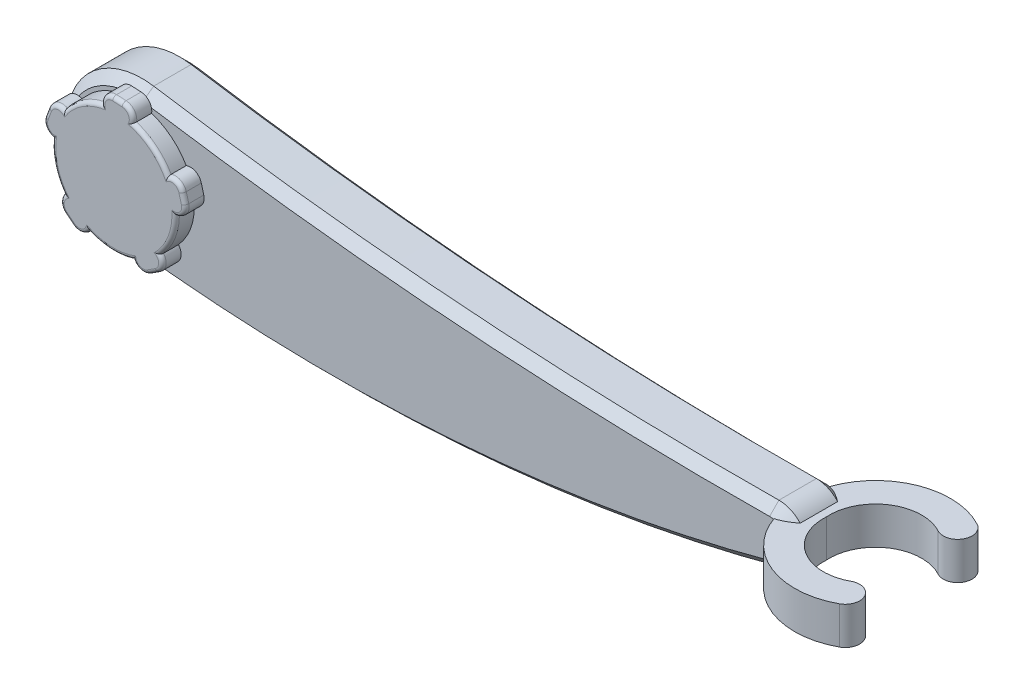
from build123d import *

# Parameters (mm, degrees)
BOSS_EXTRUDE1_DEPTH = 7.5
CHAMFER1_SIZE       = 2.5
SKETCH3_R           = 16.5
BOSS_EXTRUDE2_DEPTH = 5
BOSS_EXTRUDE7_START = -5
BOSS_EXTRUDE7_DEPTH = 5
FILLET2_R           = 1
SKETCH6_R           = 5
BOSS_EXTRUDE8_DEPTH = 10
BOSS_EXTRUDE9_START = -5
BOSS_EXTRUDE9_DEPTH = 10.000001


with BuildPart() as part:
    # Sketch1 → Boss-Extrude1 (new, symmetric)
    with BuildSketch(Plane.XY):
        with BuildLine():
            ThreePointArc((169.922137279, 7.499595816), (86.268561005, 10.133701432), (3.128243945, 19.753837344))
            ThreePointArc((3.128243945, 19.753837344), (-19.803696773, 2.795280684), (-2.461525308, -19.847944306))
            ThreePointArc((-2.461525308, -19.847944306), (85.380210023, -22.09713345), (171.984359422, -7.232725467))
            ThreePointArc((171.984359422, -7.232725467), (177.427584063, 1.039709088), (169.922137279, 7.499595816))
        make_face()
    extrude(amount=BOSS_EXTRUDE1_DEPTH, both=True)

    # Chamfer1
    chamfer1_edges = [part.edges().sort_by_distance(p)[0] for p in [
        (177.427584063, 1.039709088, 7.5),
        (86.268561005, 10.133701432, 7.5),
        (-19.803696773, 2.795280684, 7.5),
        (85.380210023, -22.09713345, 7.5),
        (-19.803696773, 2.795280684, -7.5),
        (86.268561005, 10.133701432, -7.5),
        (177.427584063, 1.039709088, -7.5),
        (85.380210023, -22.09713345, -7.5),
    ]]
    chamfer(chamfer1_edges, length=CHAMFER1_SIZE)

    # Sketch3 → Boss-Extrude2 (add)
    with BuildSketch(Plane.XY.offset(7.5)):
        Circle(SKETCH3_R)
    extrude(amount=BOSS_EXTRUDE2_DEPTH)

    # Sketch4 → Boss-Extrude7 (add)
    with BuildSketch(Plane.XY.offset(12.5).offset(BOSS_EXTRUDE7_START)):
        with BuildLine():
            ThreePointArc((-0.253915773, 19.358335376), (-2.55345676, 18.462340064), (-3.403051231, 16.145254483))
            ThreePointArc((-3.403051231, 16.145254483), (0.863543278, 16.477387323), (5.0720476, 15.701093374))
            ThreePointArc((5.0720476, 15.701093374), (4.469308692, 18.094292522), (2.276021844, 19.225746964))
            Line((2.276021844, 19.225746964), (-0.253915773, 19.358335376))
        make_face()
        with BuildLine():
            ThreePointArc((14.30344882, 8.225652062), (15.249383609, 6.301293481), (15.937776134, 4.270514244))
            Line((15.937776134, 4.270514244), (18.660254038, 5))
            Line((18.660254038, 5), (18.332406715, 6.223542865))
            ThreePointArc((18.332406715, 6.223542865), (16.76966729, 8.133658527), (14.30344882, 8.225652062))
        make_face()
        with BuildLine():
            Line((18.660254038, 5), (15.937776134, 4.270514244))
            ThreePointArc((15.937776134, 4.270514244), (16.357000338, 2.167611574), (16.499976071, 0.028100762))
            ThreePointArc((16.499976071, 0.028100762), (18.58978715, 1.340878735), (18.98810136, 3.776457135))
            Line((18.98810136, 3.776457135), (18.660254038, 5))
        make_face()
        with BuildLine():
            ThreePointArc((-11.173121868, -15.810470249), (-8.786101299, -16.437231094), (-6.736816201, -15.062048582))
            ThreePointArc((-6.736816201, -15.062048582), (-10.383786452, -12.822908364), (-13.332243835, -9.721176591))
            ThreePointArc((-13.332243835, -9.721176591), (-14.25130498, -12.011596414), (-13.141950881, -14.21614395))
            Line((-13.141950881, -14.21614395), (-11.173121868, -15.810470249))
        make_face()
        with BuildLine():
            ThreePointArc((-18.489335293, 5.740566364), (-18.347790357, 3.276695145), (-16.406650146, 1.752663965))
            ThreePointArc((-16.406650146, 1.752663965), (-15.404077037, 5.913071167), (-13.365278262, 9.675708604))
            ThreePointArc((-13.365278262, 9.675708604), (-15.827602472, 9.842009046), (-17.581442501, 8.105707948))
            Line((-17.581442501, 8.105707948), (-18.489335293, 5.740566364))
        make_face()
        with BuildLine():
            Line((0, 0), (4.972183524, -15.302807377))
            ThreePointArc((4.972183524, -15.302807377), (6.823932496, -17.203680867), (9.459270178, -16.891768097))
            Line((9.459270178, -16.891768097), (11.583966219, -15.511974356))
            ThreePointArc((11.583966219, -15.511974356), (12.940801115, -13.231339939), (11.957440933, -10.766528175))
            Line((11.957440933, -10.766528175), (0, 0))
        make_face()
    extrude(amount=BOSS_EXTRUDE7_DEPTH)

    # Fillet2
    # the kernel refuses this fillet: 1 mm, written as the material it takes off along each edge
    with BuildSketch(Plane(origin=(0, 0, 12.5), x_dir=(0.9882829908626626, 0.15263266351456553, 0), z_dir=(-0.15263266351456553, 0.9882829908626626, 0))) as fillet2_piece_1_section:
        with BuildLine():
            CenterArc((16.5 - FILLET2_R, FILLET2_R), FILLET2_R, 270, 90)
            Line((16.5, FILLET2_R), (16.5, 0))
            Line((16.5, 0), (16.5 - FILLET2_R, 0))
        make_face()
    fillet2_piece_1 = revolve(axis=Axis((0, 0, 12.5), (0, 0, -1)), revolution_arc=59.559048434, mode=Mode.PRIVATE)
    fillet2_piece_1 = fillet2_piece_1 - Plane(origin=(9.950049114, -12.995962652, 12.217360015), x_dir=(0.5446390350150123, -0.8386705679454336, 0), z_dir=(0, 0, -1)) * Cylinder(3, 67, mode=Mode.PRIVATE)
    fillet2_piece_1 = fillet2_piece_1 - Plane(origin=(16.090323881, 3, 12.217360015), x_dir=(0.13655072987786346, -0.9906330794849437, 0), z_dir=(0, 0, -1)) * Cylinder(3, 67, mode=Mode.PRIVATE)
    add(fillet2_piece_1, mode=Mode.SUBTRACT)
    with BuildSketch(Plane(origin=(7.825353073, -14.375756394, 12.5), x_dir=(-0.9277025284673782, 0.373320262877912, 0), z_dir=(0.373320262877912, 0.9277025284673782, 0))) as fillet2_piece_2_section:
        with BuildLine():
            CenterArc((3 - FILLET2_R, -FILLET2_R), FILLET2_R, 0, 90)
            Line((3, -FILLET2_R), (3, 0))
            Line((3, 0), (3 - FILLET2_R, 0))
        make_face()
    fillet2_piece_2 = revolve(axis=Axis((7.825353073, -14.375756394, 12.5), (0, 0, 1)), revolution_arc=144.920532816, mode=Mode.PRIVATE)
    fillet2_piece_2 = fillet2_piece_2 - Plane(origin=(0, 0, 12.214604541), x_dir=(1, 0, 0), z_dir=(0, 0, -1)) * Cylinder(16.5, 13, mode=Mode.PRIVATE)
    add(fillet2_piece_2, mode=Mode.SUBTRACT)
    with BuildSketch(Plane(origin=(9.459270178, -16.891768097, 12.5), x_dir=(-0.5446390350150219, 0.8386705679454275, 0), z_dir=(0.8386705679454275, 0.5446390350150219, 0)), Plane(origin=(2.276021844, 19.225746964, 12.5), x_dir=(-0.05233595624295802, -0.9986295347545733, 0), z_dir=(-0.9986295347545732, 0.05233595624295801, 0)), Plane(origin=(18.98810136, 3.776457135, 12.5), x_dir=(-0.9659258262890692, -0.25881904510251763, 0), z_dir=(-0.25881904510251763, 0.9659258262890692, 0)), Plane(origin=(-13.141950881, -14.21614395, 12.5), x_dir=(0.6293203910498446, 0.7771459614569651, 0), z_dir=(0.7771459614569651, -0.6293203910498447, 0)), Plane(origin=(-17.581442501, 8.105707948, 12.5), x_dir=(0.9335804264971966, -0.35836794954531354, 0), z_dir=(-0.35836794954531354, -0.9335804264971967, 0))) as fillet2_piece_3:
        with BuildLine():
            CenterArc((FILLET2_R, -FILLET2_R), FILLET2_R, 90, 90)
            Line((0, -FILLET2_R), (0, 0))
            Line((0, 0), (FILLET2_R, 0))
        make_face()
    extrude(amount=2.533409567, mode=Mode.SUBTRACT)
    with BuildSketch(Plane(origin=(9.950049114, -12.995962652, 12.5), x_dir=(0.5446390350150123, -0.8386705679454336, 0), z_dir=(-0.8386705679454336, -0.5446390350150123, 0))) as fillet2_piece_4_section:
        with BuildLine():
            CenterArc((3 - FILLET2_R, -FILLET2_R), FILLET2_R, 0, 90)
            Line((3, -FILLET2_R), (3, 0))
            Line((3, 0), (3 - FILLET2_R, 0))
        make_face()
    fillet2_piece_4 = revolve(axis=Axis((9.950049114, -12.995962652, 12.5), (0, 0, 1)), revolution_arc=144.920532816, mode=Mode.PRIVATE)
    fillet2_piece_4 = fillet2_piece_4 - Plane(origin=(0, 0, 12.214604544), x_dir=(1, 0, 0), z_dir=(0, 0, -1)) * Cylinder(16.5, 12, mode=Mode.PRIVATE)
    add(fillet2_piece_4, mode=Mode.SUBTRACT)
    with BuildSketch(Plane(origin=(0, 0, 12.5), x_dir=(-0.056178314026282296, 0.9984207515036755, 0), z_dir=(0.9984207515036755, 0.056178314026282296, 0))) as fillet2_piece_5_section:
        with BuildLine():
            CenterArc((16.5 - FILLET2_R, -FILLET2_R), FILLET2_R, 0, 90)
            Line((16.5, -FILLET2_R), (16.5, 0))
            Line((16.5, 0), (16.5 - FILLET2_R, 0))
        make_face()
    fillet2_piece_5 = revolve(axis=Axis((0, 0, 12.5), (0, 0, 1)), revolution_arc=59.559048434, mode=Mode.PRIVATE)
    fillet2_piece_5 = fillet2_piece_5 - Plane(origin=(-14.780701222, 7.030604099, 12.217360015), x_dir=(0.47180765348883774, 0.8817015017052863, 0), z_dir=(0, 0, -1)) * Cylinder(3, 66, mode=Mode.PRIVATE)
    fillet2_piece_5 = fillet2_piece_5 - Plane(origin=(-0.410923642, 16.362446772, 12.217360015), x_dir=(0.05233595624296897, 0.9986295347545726, 0), z_dir=(0, 0, -1)) * Cylinder(3, 66, mode=Mode.PRIVATE)
    add(fillet2_piece_5, mode=Mode.SUBTRACT)
    with BuildSketch(Plane(origin=(2.119013975, 16.22985836, 12.5), x_dir=(0.531094966353154, -0.8473123017603027, 0), z_dir=(-0.8473123017603027, -0.531094966353154, 0))) as fillet2_piece_6_section:
        with BuildLine():
            CenterArc((3 - FILLET2_R, -FILLET2_R), FILLET2_R, 0, 90)
            Line((3, -FILLET2_R), (3, 0))
            Line((3, 0), (3 - FILLET2_R, 0))
        make_face()
    fillet2_piece_6 = revolve(axis=Axis((2.119013975, 16.22985836, 12.5), (0, 0, 1)), revolution_arc=144.920532816, mode=Mode.PRIVATE)
    fillet2_piece_6 = fillet2_piece_6 - Plane(origin=(0, 0, 12.214604541), x_dir=(1, 0, 0), z_dir=(0, 0, -1)) * Cylinder(16.5, 13, mode=Mode.PRIVATE)
    add(fillet2_piece_6, mode=Mode.SUBTRACT)
    with BuildSketch(Plane(origin=(-0.410923642, 16.362446772, 12.5), x_dir=(0.05233595624296898, 0.9986295347545725, 0), z_dir=(0.9986295347545725, -0.05233595624296898, 0))) as fillet2_piece_7_section:
        with BuildLine():
            CenterArc((3 - FILLET2_R, -FILLET2_R), FILLET2_R, 0, 90)
            Line((3, -FILLET2_R), (3, 0))
            Line((3, 0), (3 - FILLET2_R, 0))
        make_face()
    fillet2_piece_7 = revolve(axis=Axis((-0.410923642, 16.362446772, 12.5), (0, 0, 1)), revolution_arc=144.920532816, mode=Mode.PRIVATE)
    fillet2_piece_7 = fillet2_piece_7 - Plane(origin=(0, 0, 12.214604544), x_dir=(1, 0, 0), z_dir=(0, 0, -1)) * Cylinder(16.5, 12, mode=Mode.PRIVATE)
    add(fillet2_piece_7, mode=Mode.SUBTRACT)
    with BuildSketch(Plane(origin=(0, 0, 12.5), x_dir=(0.9321945079724108, 0.36195773138044035, 0), z_dir=(0.36195773138044035, -0.9321945079724108, 0))) as fillet2_piece_8_section:
        with BuildLine():
            CenterArc((16.5 - FILLET2_R, -FILLET2_R), FILLET2_R, 0, 90)
            Line((16.5, -FILLET2_R), (16.5, 0))
            Line((16.5, 0), (16.5 - FILLET2_R, 0))
        make_face()
    fillet2_piece_8 = revolve(axis=Axis((0, 0, 12.5), (0, 0, 1)), revolution_arc=59.559048434, mode=Mode.PRIVATE)
    fillet2_piece_8 = fillet2_piece_8 - Plane(origin=(15.434629236, 5.447085729, 12.217360015), x_dir=(0.9659258262890718, 0.25881904510250797, 0), z_dir=(0, 0, -1)) * Cylinder(3, 67, mode=Mode.PRIVATE)
    fillet2_piece_8 = fillet2_piece_8 - Plane(origin=(2.119013975, 16.22985836, 12.217360015), x_dir=(0.984344541628251, -0.1762549952956468, 0), z_dir=(0, 0, -1)) * Cylinder(3, 67, mode=Mode.PRIVATE)
    add(fillet2_piece_8, mode=Mode.SUBTRACT)
    with BuildSketch(Plane(origin=(16.090323881, 3, 12.5), x_dir=(-0.6417245156960575, -0.7669352293086167, 0), z_dir=(-0.7669352293086167, 0.6417245156960575, 0))) as fillet2_piece_9_section:
        with BuildLine():
            CenterArc((3 - FILLET2_R, -FILLET2_R), FILLET2_R, 0, 90)
            Line((3, -FILLET2_R), (3, 0))
            Line((3, 0), (3 - FILLET2_R, 0))
        make_face()
    fillet2_piece_9 = revolve(axis=Axis((16.090323881, 3, 12.5), (0, 0, 1)), revolution_arc=144.920532816, mode=Mode.PRIVATE)
    fillet2_piece_9 = fillet2_piece_9 - Plane(origin=(0, 0, 12.214604541), x_dir=(1, 0, 0), z_dir=(0, 0, -1)) * Cylinder(16.5, 12, mode=Mode.PRIVATE)
    add(fillet2_piece_9, mode=Mode.SUBTRACT)
    with BuildSketch(Plane(origin=(15.434629236, 5.447085729, 12.5), x_dir=(0.9659258262890718, 0.25881904510250797, 0), z_dir=(0.25881904510250797, -0.9659258262890718, 0))) as fillet2_piece_10_section:
        with BuildLine():
            CenterArc((3 - FILLET2_R, -FILLET2_R), FILLET2_R, 0, 90)
            Line((3, -FILLET2_R), (3, 0))
            Line((3, 0), (3 - FILLET2_R, 0))
        make_face()
    fillet2_piece_10 = revolve(axis=Axis((15.434629236, 5.447085729, 12.5), (0, 0, 1)), revolution_arc=144.920532816, mode=Mode.PRIVATE)
    fillet2_piece_10 = fillet2_piece_10 - Plane(origin=(0, 0, 12.214604544), x_dir=(1, 0, 0), z_dir=(0, 0, -1)) * Cylinder(16.5, 13, mode=Mode.PRIVATE)
    add(fillet2_piece_10, mode=Mode.SUBTRACT)
    with BuildSketch(Plane(origin=(0, 0, 12.5), x_dir=(-0.5414077825540178, -0.8407601399863943, 0), z_dir=(-0.8407601399863943, 0.5414077825540178, 0))) as fillet2_piece_11_section:
        with BuildLine():
            CenterArc((16.5 - FILLET2_R, -FILLET2_R), FILLET2_R, 0, 90)
            Line((16.5, -FILLET2_R), (16.5, 0))
            Line((16.5, 0), (16.5 - FILLET2_R, 0))
        make_face()
    fillet2_piece_11 = revolve(axis=Axis((0, 0, 12.5), (0, 0, 1)), revolution_arc=59.559048434, mode=Mode.PRIVATE)
    fillet2_piece_11 = fillet2_piece_11 - Plane(origin=(-9.285160694, -13.479032365, 12.217360017), x_dir=(-0.6293203910498518, -0.7771459614569592, 0), z_dir=(0, 0, -1)) * Cylinder(3, 66, mode=Mode.PRIVATE)
    fillet2_piece_11 = fillet2_piece_11 - Plane(origin=(7.825353073, -14.375756394, 12.217360017), x_dir=(-0.9510565162951571, -0.30901699437493685, 0), z_dir=(0, 0, -1)) * Cylinder(3, 66, mode=Mode.PRIVATE)
    add(fillet2_piece_11, mode=Mode.SUBTRACT)
    with BuildSketch(Plane(origin=(-11.253989708, -11.884706065, 12.5), x_dir=(0.06837282165404092, 0.997659840456187, 0), z_dir=(0.997659840456187, -0.06837282165404092, 0))) as fillet2_piece_12_section:
        with BuildLine():
            CenterArc((3 - FILLET2_R, -FILLET2_R), FILLET2_R, 0, 90)
            Line((3, -FILLET2_R), (3, 0))
            Line((3, 0), (3 - FILLET2_R, 0))
        make_face()
    fillet2_piece_12 = revolve(axis=Axis((-11.253989708, -11.884706065, 12.5), (0, 0, 1)), revolution_arc=144.920532816, mode=Mode.PRIVATE)
    fillet2_piece_12 = fillet2_piece_12 - Plane(origin=(0, 0, 12.214604541), x_dir=(1, 0, 0), z_dir=(0, 0, -1)) * Cylinder(16.5, 12, mode=Mode.PRIVATE)
    add(fillet2_piece_12, mode=Mode.SUBTRACT)
    with BuildSketch(Plane(origin=(-9.285160694, -13.479032365, 12.5), x_dir=(-0.6293203910498518, -0.7771459614569592, 0), z_dir=(-0.7771459614569592, 0.6293203910498518, 0))) as fillet2_piece_13_section:
        with BuildLine():
            CenterArc((3 - FILLET2_R, -FILLET2_R), FILLET2_R, 0, 90)
            Line((3 - FILLET2_R, 0), (3, 0))
            Line((3, 0), (3, -FILLET2_R))
        make_face()
    fillet2_piece_13 = revolve(axis=Axis((-9.285160694, -13.479032365, 12.5), (0, 0, 1)), revolution_arc=144.920532816, mode=Mode.PRIVATE)
    fillet2_piece_13 = fillet2_piece_13 - Plane(origin=(0, 0, 12.214604544), x_dir=(1, 0, 0), z_dir=(0, 0, -1)) * Cylinder(16.5, 13, mode=Mode.PRIVATE)
    add(fillet2_piece_13, mode=Mode.SUBTRACT)
    with BuildSketch(Plane(origin=(0, 0, 12.5), x_dir=(-0.9669146154713337, 0.25510022812205163, 0), z_dir=(0.25510022812205163, 0.9669146154713337, 0))) as fillet2_piece_14_section:
        with BuildLine():
            CenterArc((16.5 - FILLET2_R, -FILLET2_R), FILLET2_R, 0, 90)
            Line((16.5, -FILLET2_R), (16.5, 0))
            Line((16.5, 0), (16.5 - FILLET2_R, 0))
        make_face()
    fillet2_piece_14 = revolve(axis=Axis((0, 0, 12.5), (0, 0, 1)), revolution_arc=59.559048434, mode=Mode.PRIVATE)
    fillet2_piece_14 = fillet2_piece_14 - Plane(origin=(-11.253989708, -11.884706065, 12.217360022), x_dir=(-0.6927513756197861, 0.7211764912813604, 0), z_dir=(0, 0, -1)) * Cylinder(3, 67, mode=Mode.PRIVATE)
    fillet2_piece_14 = fillet2_piece_14 - Plane(origin=(-15.688594014, 4.665462515, 12.217360022), x_dir=(-0.9335804264971939, 0.3583679495453211, 0), z_dir=(0, 0, -1)) * Cylinder(3, 67, mode=Mode.PRIVATE)
    add(fillet2_piece_14, mode=Mode.SUBTRACT)
    with BuildSketch(Plane(origin=(-14.780701222, 7.030604099, 12.5), x_dir=(0.9699592561562955, 0.24326742773484047, 0), z_dir=(0.24326742773484047, -0.9699592561562955, 0))) as fillet2_piece_15_section:
        with BuildLine():
            CenterArc((3 - FILLET2_R, -FILLET2_R), FILLET2_R, 0, 90)
            Line((3, -FILLET2_R), (3, 0))
            Line((3, 0), (3 - FILLET2_R, 0))
        make_face()
    fillet2_piece_15 = revolve(axis=Axis((-14.780701222, 7.030604099, 12.5), (0, 0, 1)), revolution_arc=144.920532816, mode=Mode.PRIVATE)
    fillet2_piece_15 = fillet2_piece_15 - Plane(origin=(0, 0, 12.214604541), x_dir=(1, 0, 0), z_dir=(0, 0, -1)) * Cylinder(16.5, 12, mode=Mode.PRIVATE)
    add(fillet2_piece_15, mode=Mode.SUBTRACT)
    with BuildSketch(Plane(origin=(-15.688594014, 4.665462515, 12.5), x_dir=(-0.9335804264971937, 0.35836794954532103, 0), z_dir=(0.35836794954532103, 0.9335804264971937, 0))) as fillet2_piece_16_section:
        with BuildLine():
            CenterArc((3 - FILLET2_R, -FILLET2_R), FILLET2_R, 0, 90)
            Line((3, -FILLET2_R), (3, 0))
            Line((3, 0), (3 - FILLET2_R, 0))
        make_face()
    fillet2_piece_16 = revolve(axis=Axis((-15.688594014, 4.665462515, 12.5), (0, 0, 1)), revolution_arc=144.920532816, mode=Mode.PRIVATE)
    fillet2_piece_16 = fillet2_piece_16 - Plane(origin=(0, 0, 12.214604544), x_dir=(1, 0, 0), z_dir=(0, 0, -1)) * Cylinder(16.5, 12, mode=Mode.PRIVATE)
    add(fillet2_piece_16, mode=Mode.SUBTRACT)
    with BuildSketch(Plane(origin=(0, 0, 12.5), x_dir=(0.9882829908626626, 0.15263266351456553, 0), z_dir=(-0.15263266351456553, 0.9882829908626626, 0))) as fillet2_piece_17a_section:
        with BuildLine():
            CenterArc((16.5 - FILLET2_R, FILLET2_R), FILLET2_R, 270, 90)
            Line((16.5, FILLET2_R), (16.5, 0))
            Line((16.5, 0), (16.5 - FILLET2_R, 0))
        make_face()
    fillet2_piece_17a = revolve(axis=Axis((0, 0, 12.5), (0, 0, -1)), revolution_arc=59.559048434, mode=Mode.PRIVATE)
    fillet2_piece_17a = fillet2_piece_17a & Plane(origin=(16.090323881, 3, 12.272335975), x_dir=(0.13655072987786346, -0.9906330794849437, 0), z_dir=(0, 0, -1)) * Cylinder(3, 67, mode=Mode.PRIVATE)
    with BuildSketch(Plane(origin=(16.090323881, 3, 12.5), x_dir=(-0.6417245156960575, -0.7669352293086167, 0), z_dir=(-0.7669352293086167, 0.6417245156960575, 0))) as fillet2_piece_17b_section:
        with BuildLine():
            CenterArc((3 - FILLET2_R, -FILLET2_R), FILLET2_R, 0, 90)
            Line((3, -FILLET2_R), (3, 0))
            Line((3, 0), (3 - FILLET2_R, 0))
        make_face()
    fillet2_piece_17b = revolve(axis=Axis((16.090323881, 3, 12.5), (0, 0, 1)), revolution_arc=144.920532816, mode=Mode.PRIVATE)
    fillet2_piece_17b = fillet2_piece_17b & Plane(origin=(0, 0, 12.265208133), x_dir=(1, 0, 0), z_dir=(0, 0, -1)) * Cylinder(16.5, 12, mode=Mode.PRIVATE)
    fillet2_piece_17 = fillet2_piece_17a & fillet2_piece_17b
    add(fillet2_piece_17, mode=Mode.SUBTRACT)
    with BuildSketch(Plane(origin=(9.950049114, -12.995962652, 12.5), x_dir=(0.5446390350150123, -0.8386705679454336, 0), z_dir=(-0.8386705679454336, -0.5446390350150123, 0))) as fillet2_piece_18a_section:
        with BuildLine():
            CenterArc((3 - FILLET2_R, -FILLET2_R), FILLET2_R, 0, 90)
            Line((3, -FILLET2_R), (3, 0))
            Line((3, 0), (3 - FILLET2_R, 0))
        make_face()
    fillet2_piece_18a = revolve(axis=Axis((9.950049114, -12.995962652, 12.5), (0, 0, 1)), revolution_arc=144.920532816, mode=Mode.PRIVATE)
    fillet2_piece_18a = fillet2_piece_18a & Plane(origin=(0, 0, 12.265208136), x_dir=(1, 0, 0), z_dir=(0, 0, -1)) * Cylinder(16.5, 12, mode=Mode.PRIVATE)
    with BuildSketch(Plane(origin=(0, 0, 12.5), x_dir=(0.9882829908626626, 0.15263266351456553, 0), z_dir=(-0.15263266351456553, 0.9882829908626626, 0))) as fillet2_piece_18b_section:
        with BuildLine():
            CenterArc((16.5 - FILLET2_R, FILLET2_R), FILLET2_R, 270, 90)
            Line((16.5, FILLET2_R), (16.5, 0))
            Line((16.5, 0), (16.5 - FILLET2_R, 0))
        make_face()
    fillet2_piece_18b = revolve(axis=Axis((0, 0, 12.5), (0, 0, -1)), revolution_arc=59.559048434, mode=Mode.PRIVATE)
    fillet2_piece_18b = fillet2_piece_18b & Plane(origin=(9.950049114, -12.995962652, 12.272335965), x_dir=(0.5446390350150123, -0.8386705679454336, 0), z_dir=(0, 0, -1)) * Cylinder(3, 67, mode=Mode.PRIVATE)
    fillet2_piece_18 = fillet2_piece_18a & fillet2_piece_18b
    add(fillet2_piece_18, mode=Mode.SUBTRACT)
    with BuildSketch(Plane(origin=(0, 0, 12.5), x_dir=(-0.5414077825540178, -0.8407601399863943, 0), z_dir=(-0.8407601399863943, 0.5414077825540178, 0))) as fillet2_piece_19a_section:
        with BuildLine():
            CenterArc((16.5 - FILLET2_R, -FILLET2_R), FILLET2_R, 0, 90)
            Line((16.5, -FILLET2_R), (16.5, 0))
            Line((16.5, 0), (16.5 - FILLET2_R, 0))
        make_face()
    fillet2_piece_19a = revolve(axis=Axis((0, 0, 12.5), (0, 0, 1)), revolution_arc=59.559048434, mode=Mode.PRIVATE)
    fillet2_piece_19a = fillet2_piece_19a & Plane(origin=(7.825353073, -14.375756394, 12.272335956), x_dir=(-0.9510565162951571, -0.30901699437493685, 0), z_dir=(0, 0, -1)) * Cylinder(3, 66, mode=Mode.PRIVATE)
    with BuildSketch(Plane(origin=(7.825353073, -14.375756394, 12.5), x_dir=(-0.9277025284673782, 0.373320262877912, 0), z_dir=(0.373320262877912, 0.9277025284673782, 0))) as fillet2_piece_19b_section:
        with BuildLine():
            CenterArc((3 - FILLET2_R, -FILLET2_R), FILLET2_R, 0, 90)
            Line((3, -FILLET2_R), (3, 0))
            Line((3, 0), (3 - FILLET2_R, 0))
        make_face()
    fillet2_piece_19b = revolve(axis=Axis((7.825353073, -14.375756394, 12.5), (0, 0, 1)), revolution_arc=144.920532816, mode=Mode.PRIVATE)
    fillet2_piece_19b = fillet2_piece_19b & Plane(origin=(0, 0, 12.265208133), x_dir=(1, 0, 0), z_dir=(0, 0, -1)) * Cylinder(16.5, 13, mode=Mode.PRIVATE)
    fillet2_piece_19 = fillet2_piece_19a & fillet2_piece_19b
    add(fillet2_piece_19, mode=Mode.SUBTRACT)
    with BuildSketch(Plane(origin=(-0.410923642, 16.362446772, 12.5), x_dir=(0.05233595624296898, 0.9986295347545725, 0), z_dir=(0.9986295347545725, -0.05233595624296898, 0))) as fillet2_piece_20a_section:
        with BuildLine():
            CenterArc((3 - FILLET2_R, -FILLET2_R), FILLET2_R, 0, 90)
            Line((3, -FILLET2_R), (3, 0))
            Line((3, 0), (3 - FILLET2_R, 0))
        make_face()
    fillet2_piece_20a = revolve(axis=Axis((-0.410923642, 16.362446772, 12.5), (0, 0, 1)), revolution_arc=144.920532816, mode=Mode.PRIVATE)
    fillet2_piece_20a = fillet2_piece_20a & Plane(origin=(0, 0, 12.265208136), x_dir=(1, 0, 0), z_dir=(0, 0, -1)) * Cylinder(16.5, 12, mode=Mode.PRIVATE)
    with BuildSketch(Plane(origin=(0, 0, 12.5), x_dir=(-0.056178314026282296, 0.9984207515036755, 0), z_dir=(0.9984207515036755, 0.056178314026282296, 0))) as fillet2_piece_20b_section:
        with BuildLine():
            CenterArc((16.5 - FILLET2_R, -FILLET2_R), FILLET2_R, 0, 90)
            Line((16.5, -FILLET2_R), (16.5, 0))
            Line((16.5, 0), (16.5 - FILLET2_R, 0))
        make_face()
    fillet2_piece_20b = revolve(axis=Axis((0, 0, 12.5), (0, 0, 1)), revolution_arc=59.559048434, mode=Mode.PRIVATE)
    fillet2_piece_20b = fillet2_piece_20b & Plane(origin=(-0.410923642, 16.362446772, 12.272335969), x_dir=(0.05233595624296897, 0.9986295347545726, 0), z_dir=(0, 0, -1)) * Cylinder(3, 66, mode=Mode.PRIVATE)
    fillet2_piece_20 = fillet2_piece_20a & fillet2_piece_20b
    add(fillet2_piece_20, mode=Mode.SUBTRACT)
    with BuildSketch(Plane(origin=(0, 0, 12.5), x_dir=(-0.056178314026282296, 0.9984207515036755, 0), z_dir=(0.9984207515036755, 0.056178314026282296, 0))) as fillet2_piece_21a_section:
        with BuildLine():
            CenterArc((16.5 - FILLET2_R, -FILLET2_R), FILLET2_R, 0, 90)
            Line((16.5, -FILLET2_R), (16.5, 0))
            Line((16.5, 0), (16.5 - FILLET2_R, 0))
        make_face()
    fillet2_piece_21a = revolve(axis=Axis((0, 0, 12.5), (0, 0, 1)), revolution_arc=59.559048434, mode=Mode.PRIVATE)
    fillet2_piece_21a = fillet2_piece_21a & Plane(origin=(-14.780701222, 7.030604099, 12.272335971), x_dir=(0.47180765348883774, 0.8817015017052863, 0), z_dir=(0, 0, -1)) * Cylinder(3, 66, mode=Mode.PRIVATE)
    with BuildSketch(Plane(origin=(-14.780701222, 7.030604099, 12.5), x_dir=(0.9699592561562955, 0.24326742773484047, 0), z_dir=(0.24326742773484047, -0.9699592561562955, 0))) as fillet2_piece_21b_section:
        with BuildLine():
            CenterArc((3 - FILLET2_R, -FILLET2_R), FILLET2_R, 0, 90)
            Line((3, -FILLET2_R), (3, 0))
            Line((3, 0), (3 - FILLET2_R, 0))
        make_face()
    fillet2_piece_21b = revolve(axis=Axis((-14.780701222, 7.030604099, 12.5), (0, 0, 1)), revolution_arc=144.920532816, mode=Mode.PRIVATE)
    fillet2_piece_21b = fillet2_piece_21b & Plane(origin=(0, 0, 12.265208133), x_dir=(1, 0, 0), z_dir=(0, 0, -1)) * Cylinder(16.5, 12, mode=Mode.PRIVATE)
    fillet2_piece_21 = fillet2_piece_21a & fillet2_piece_21b
    add(fillet2_piece_21, mode=Mode.SUBTRACT)
    with BuildSketch(Plane(origin=(2.119013975, 16.22985836, 12.5), x_dir=(0.531094966353154, -0.8473123017603027, 0), z_dir=(-0.8473123017603027, -0.531094966353154, 0))) as fillet2_piece_22a_section:
        with BuildLine():
            CenterArc((3 - FILLET2_R, -FILLET2_R), FILLET2_R, 0, 90)
            Line((3, -FILLET2_R), (3, 0))
            Line((3, 0), (3 - FILLET2_R, 0))
        make_face()
    fillet2_piece_22a = revolve(axis=Axis((2.119013975, 16.22985836, 12.5), (0, 0, 1)), revolution_arc=144.920532816, mode=Mode.PRIVATE)
    fillet2_piece_22a = fillet2_piece_22a & Plane(origin=(0, 0, 12.265208133), x_dir=(1, 0, 0), z_dir=(0, 0, -1)) * Cylinder(16.5, 13, mode=Mode.PRIVATE)
    with BuildSketch(Plane(origin=(0, 0, 12.5), x_dir=(0.9321945079724108, 0.36195773138044035, 0), z_dir=(0.36195773138044035, -0.9321945079724108, 0))) as fillet2_piece_22b_section:
        with BuildLine():
            CenterArc((16.5 - FILLET2_R, -FILLET2_R), FILLET2_R, 0, 90)
            Line((16.5, -FILLET2_R), (16.5, 0))
            Line((16.5, 0), (16.5 - FILLET2_R, 0))
        make_face()
    fillet2_piece_22b = revolve(axis=Axis((0, 0, 12.5), (0, 0, 1)), revolution_arc=59.559048434, mode=Mode.PRIVATE)
    fillet2_piece_22b = fillet2_piece_22b & Plane(origin=(2.119013975, 16.22985836, 12.272335971), x_dir=(0.984344541628251, -0.1762549952956468, 0), z_dir=(0, 0, -1)) * Cylinder(3, 67, mode=Mode.PRIVATE)
    fillet2_piece_22 = fillet2_piece_22a & fillet2_piece_22b
    add(fillet2_piece_22, mode=Mode.SUBTRACT)
    with BuildSketch(Plane(origin=(15.434629236, 5.447085729, 12.5), x_dir=(0.9659258262890718, 0.25881904510250797, 0), z_dir=(0.25881904510250797, -0.9659258262890718, 0))) as fillet2_piece_23a_section:
        with BuildLine():
            CenterArc((3 - FILLET2_R, -FILLET2_R), FILLET2_R, 0, 90)
            Line((3, -FILLET2_R), (3, 0))
            Line((3, 0), (3 - FILLET2_R, 0))
        make_face()
    fillet2_piece_23a = revolve(axis=Axis((15.434629236, 5.447085729, 12.5), (0, 0, 1)), revolution_arc=144.920532816, mode=Mode.PRIVATE)
    fillet2_piece_23a = fillet2_piece_23a & Plane(origin=(0, 0, 12.265208136), x_dir=(1, 0, 0), z_dir=(0, 0, -1)) * Cylinder(16.5, 13, mode=Mode.PRIVATE)
    with BuildSketch(Plane(origin=(0, 0, 12.5), x_dir=(0.9321945079724108, 0.36195773138044035, 0), z_dir=(0.36195773138044035, -0.9321945079724108, 0))) as fillet2_piece_23b_section:
        with BuildLine():
            CenterArc((16.5 - FILLET2_R, -FILLET2_R), FILLET2_R, 0, 90)
            Line((16.5, -FILLET2_R), (16.5, 0))
            Line((16.5, 0), (16.5 - FILLET2_R, 0))
        make_face()
    fillet2_piece_23b = revolve(axis=Axis((0, 0, 12.5), (0, 0, 1)), revolution_arc=59.559048434, mode=Mode.PRIVATE)
    fillet2_piece_23b = fillet2_piece_23b & Plane(origin=(15.434629236, 5.447085729, 12.272335969), x_dir=(0.9659258262890718, 0.25881904510250797, 0), z_dir=(0, 0, -1)) * Cylinder(3, 67, mode=Mode.PRIVATE)
    fillet2_piece_23 = fillet2_piece_23a & fillet2_piece_23b
    add(fillet2_piece_23, mode=Mode.SUBTRACT)
    with BuildSketch(Plane(origin=(-9.285160694, -13.479032365, 12.5), x_dir=(-0.6293203910498518, -0.7771459614569592, 0), z_dir=(-0.7771459614569592, 0.6293203910498518, 0))) as fillet2_piece_24a_section:
        with BuildLine():
            CenterArc((3 - FILLET2_R, -FILLET2_R), FILLET2_R, 0, 90)
            Line((3 - FILLET2_R, 0), (3, 0))
            Line((3, 0), (3, -FILLET2_R))
        make_face()
    fillet2_piece_24a = revolve(axis=Axis((-9.285160694, -13.479032365, 12.5), (0, 0, 1)), revolution_arc=144.920532816, mode=Mode.PRIVATE)
    fillet2_piece_24a = fillet2_piece_24a & Plane(origin=(0, 0, 12.265208139), x_dir=(1, 0, 0), z_dir=(0, 0, -1)) * Cylinder(16.5, 13, mode=Mode.PRIVATE)
    with BuildSketch(Plane(origin=(0, 0, 12.5), x_dir=(-0.5414077825540178, -0.8407601399863943, 0), z_dir=(-0.8407601399863943, 0.5414077825540178, 0))) as fillet2_piece_24b_section:
        with BuildLine():
            CenterArc((16.5 - FILLET2_R, -FILLET2_R), FILLET2_R, 0, 90)
            Line((16.5, -FILLET2_R), (16.5, 0))
            Line((16.5, 0), (16.5 - FILLET2_R, 0))
        make_face()
    fillet2_piece_24b = revolve(axis=Axis((0, 0, 12.5), (0, 0, 1)), revolution_arc=59.559048434, mode=Mode.PRIVATE)
    fillet2_piece_24b = fillet2_piece_24b & Plane(origin=(-9.285160694, -13.479032365, 12.272335969), x_dir=(-0.6293203910498518, -0.7771459614569592, 0), z_dir=(0, 0, -1)) * Cylinder(3, 66, mode=Mode.PRIVATE)
    fillet2_piece_24 = fillet2_piece_24a & fillet2_piece_24b
    add(fillet2_piece_24, mode=Mode.SUBTRACT)
    with BuildSketch(Plane(origin=(0, 0, 12.5), x_dir=(-0.9669146154713337, 0.25510022812205163, 0), z_dir=(0.25510022812205163, 0.9669146154713337, 0))) as fillet2_piece_25a_section:
        with BuildLine():
            CenterArc((16.5 - FILLET2_R, -FILLET2_R), FILLET2_R, 0, 90)
            Line((16.5, -FILLET2_R), (16.5, 0))
            Line((16.5, 0), (16.5 - FILLET2_R, 0))
        make_face()
    fillet2_piece_25a = revolve(axis=Axis((0, 0, 12.5), (0, 0, 1)), revolution_arc=59.559048434, mode=Mode.PRIVATE)
    fillet2_piece_25a = fillet2_piece_25a & Plane(origin=(-11.253989708, -11.884706065, 12.272335725), x_dir=(-0.6927513756197861, 0.7211764912813604, 0), z_dir=(0, 0, -1)) * Cylinder(3, 67, mode=Mode.PRIVATE)
    with BuildSketch(Plane(origin=(-11.253989708, -11.884706065, 12.5), x_dir=(0.06837282165404092, 0.997659840456187, 0), z_dir=(0.997659840456187, -0.06837282165404092, 0))) as fillet2_piece_25b_section:
        with BuildLine():
            CenterArc((3 - FILLET2_R, -FILLET2_R), FILLET2_R, 0, 90)
            Line((3, -FILLET2_R), (3, 0))
            Line((3, 0), (3 - FILLET2_R, 0))
        make_face()
    fillet2_piece_25b = revolve(axis=Axis((-11.253989708, -11.884706065, 12.5), (0, 0, 1)), revolution_arc=144.920532816, mode=Mode.PRIVATE)
    fillet2_piece_25b = fillet2_piece_25b & Plane(origin=(0, 0, 12.265208133), x_dir=(1, 0, 0), z_dir=(0, 0, -1)) * Cylinder(16.5, 12, mode=Mode.PRIVATE)
    fillet2_piece_25 = fillet2_piece_25a & fillet2_piece_25b
    add(fillet2_piece_25, mode=Mode.SUBTRACT)
    with BuildSketch(Plane(origin=(-15.688594014, 4.665462515, 12.5), x_dir=(-0.9335804264971937, 0.35836794954532103, 0), z_dir=(0.35836794954532103, 0.9335804264971937, 0))) as fillet2_piece_26a_section:
        with BuildLine():
            CenterArc((3 - FILLET2_R, -FILLET2_R), FILLET2_R, 0, 90)
            Line((3, -FILLET2_R), (3, 0))
            Line((3, 0), (3 - FILLET2_R, 0))
        make_face()
    fillet2_piece_26a = revolve(axis=Axis((-15.688594014, 4.665462515, 12.5), (0, 0, 1)), revolution_arc=144.920532816, mode=Mode.PRIVATE)
    fillet2_piece_26a = fillet2_piece_26a & Plane(origin=(0, 0, 12.265208136), x_dir=(1, 0, 0), z_dir=(0, 0, -1)) * Cylinder(16.5, 12, mode=Mode.PRIVATE)
    with BuildSketch(Plane(origin=(0, 0, 12.5), x_dir=(-0.9669146154713337, 0.25510022812205163, 0), z_dir=(0.25510022812205163, 0.9669146154713337, 0))) as fillet2_piece_26b_section:
        with BuildLine():
            CenterArc((16.5 - FILLET2_R, -FILLET2_R), FILLET2_R, 0, 90)
            Line((16.5, -FILLET2_R), (16.5, 0))
            Line((16.5, 0), (16.5 - FILLET2_R, 0))
        make_face()
    fillet2_piece_26b = revolve(axis=Axis((0, 0, 12.5), (0, 0, 1)), revolution_arc=59.559048434, mode=Mode.PRIVATE)
    fillet2_piece_26b = fillet2_piece_26b & Plane(origin=(-15.688594014, 4.665462515, 12.272335969), x_dir=(-0.9335804264971939, 0.3583679495453211, 0), z_dir=(0, 0, -1)) * Cylinder(3, 67, mode=Mode.PRIVATE)
    fillet2_piece_26 = fillet2_piece_26a & fillet2_piece_26b
    add(fillet2_piece_26, mode=Mode.SUBTRACT)

    # Sketch6 → Boss-Extrude8 (add)
    with BuildSketch(Plane(origin=(0, 0, -7.5), x_dir=(-1, 0, 0), z_dir=(0, 0, -1))):
        with Locations(Location((0, 0, 0), (0, 0, 180))):
            Circle(SKETCH6_R)
    extrude(amount=BOSS_EXTRUDE8_DEPTH)

    # Sketch8 → Boss-Extrude9 (add)
    with BuildSketch(Plane(origin=(0, 0, 0), x_dir=(1, 0, 0), z_dir=(0, 1, 0)).offset(BOSS_EXTRUDE9_START)):
        with BuildLine():
            ThreePointArc((169.922137279, 0), (179.336823336, 17.771400384), (199.438940474, 18.374618175))
            ThreePointArc((199.438940474, 18.374618175), (200.983940437, 13.170381788), (195.779704051, 11.625381825))
            ThreePointArc((195.779704051, 11.625381825), (183.265361965, 11.172427676), (177.609322263, 0))
            ThreePointArc((177.609322263, 0), (183.265361965, -11.172427676), (195.779704051, -11.625381825))
            ThreePointArc((195.779704051, -11.625381825), (200.983940437, -13.170381788), (199.438940474, -18.374618175))
            ThreePointArc((199.438940474, -18.374618175), (179.336823336, -17.771400384), (169.922137279, 0))
        make_face()
    extrude(amount=BOSS_EXTRUDE9_DEPTH)


solid = part.part
